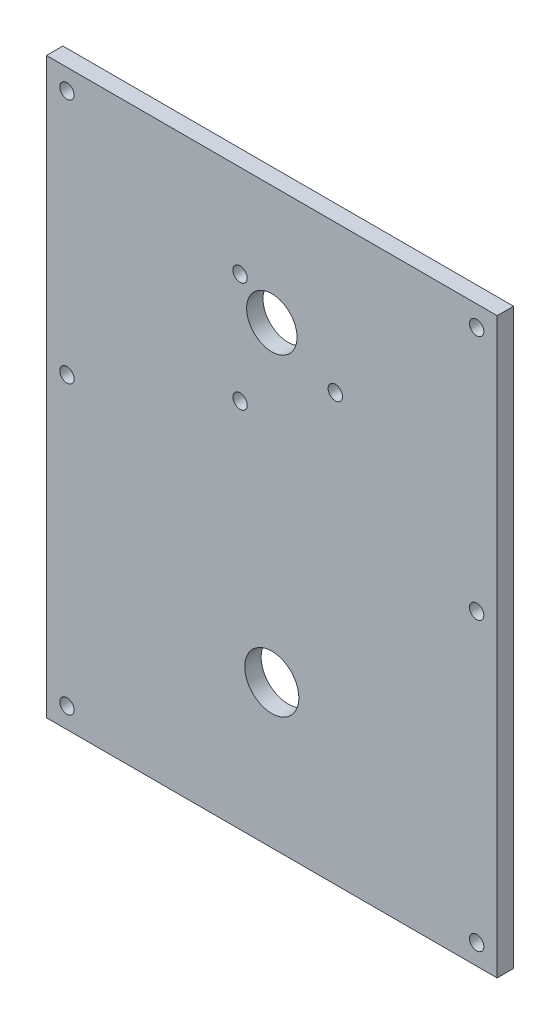
from build123d import *

# Parameters (mm, degrees)
SKETCH_1_R      = 1.75
EXTRUDE_1_DEPTH = 4


with BuildPart() as part:
    # ｽｹｯﾁ1 → ﾎﾞｽ - 押し出し1 (new body)
    with BuildSketch(Plane.XY):
        Polygon((0, 0), (55, 0), (110, 0), (110, 140), (0, 140), align=None)
        with Locations((5, 135)):
            Circle(SKETCH_1_R, mode=Mode.SUBTRACT)
        with Locations((105, 5)):
            Circle(SKETCH_1_R, mode=Mode.SUBTRACT)
        with Locations((5, 5)):
            Circle(SKETCH_1_R, mode=Mode.SUBTRACT)
        with BuildLine():
            ThreePointArc((55, 28.4), (48.4, 35), (55, 41.6))
            ThreePointArc((55, 41.6), (61.6, 35), (55, 28.4))
        make_face(mode=Mode.SUBTRACT)
        with Locations((5, 75)):
            Circle(SKETCH_1_R, mode=Mode.SUBTRACT)
        with Locations((47.25, 90.576606241)):
            Circle(SKETCH_1_R, mode=Mode.SUBTRACT)
        with Locations((47.25, 117.423393759)):
            Circle(SKETCH_1_R, mode=Mode.SUBTRACT)
        with Locations((70.5, 104)):
            Circle(SKETCH_1_R, mode=Mode.SUBTRACT)
        with Locations((105, 75)):
            Circle(SKETCH_1_R, mode=Mode.SUBTRACT)
        with BuildLine():
            ThreePointArc((54.497374059, 104.870573668), (49.673943767, 107.925), (49.440448115, 113.629426332))
            ThreePointArc((49.440448115, 113.629426332), (60.326056233, 114.075), (54.497374059, 104.870573668))
        make_face(mode=Mode.SUBTRACT)
        with Locations((105, 135)):
            Circle(SKETCH_1_R, mode=Mode.SUBTRACT)
    extrude(amount=EXTRUDE_1_DEPTH)


solid = part.part
